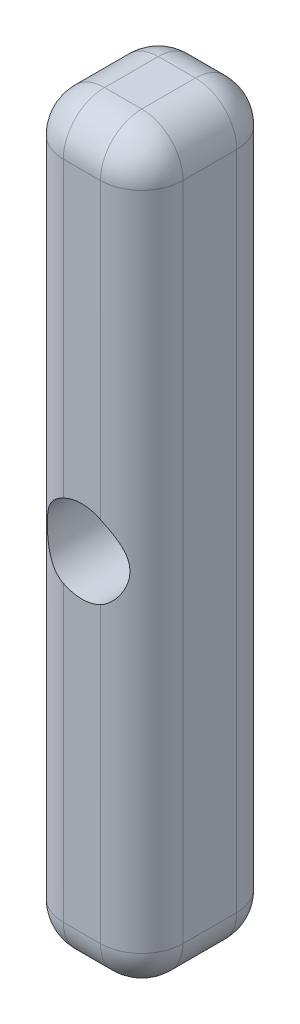
from build123d import *

# Parameters (mm, degrees)
SKETCH7_W           = 90
SKETCH7_H           = 14.5
BOSS_EXTRUDE1_DEPTH = 16.5
SKETCH8_R           = 5
CUT_EXTRUDE2_DEPTH  = 13
FILLET1_R           = 5


with BuildPart() as part:
    # Sketch7 → Boss-Extrude1 (new body)
    with BuildSketch(Plane(origin=(0, 0, 0), x_dir=(0, 1, 0), z_dir=(0, 0, 1))):
        Rectangle(SKETCH7_W, SKETCH7_H)
    extrude(amount=BOSS_EXTRUDE1_DEPTH)

    # Sketch8 → Cut-Extrude2 (cut)
    with BuildSketch(Plane(origin=(0, 0, 16.5), x_dir=(0, -1, 0), z_dir=(0, 0, 1))):
        with Locations(Location((0, 0, 0), (0, 0, 90))):
            Circle(SKETCH8_R)
    extrude(amount=-CUT_EXTRUDE2_DEPTH, mode=Mode.SUBTRACT)

    # Fillet1
    # the kernel refuses this fillet: 5 mm, written as the material it takes off along each edge
    with BuildSketch(Plane(origin=(-2.25, -40, 11.5), x_dir=(0, 0, 1), z_dir=(0, -1, 0))) as fillet1_piece_1_section:
        Polygon((0, 0), (FILLET1_R, 0), (FILLET1_R, FILLET1_R), (0, FILLET1_R), align=None)
    fillet1_piece_1 = extrude(amount=FILLET1_R, mode=Mode.PRIVATE)
    fillet1_piece_1 = fillet1_piece_1 - Plane(origin=(-2.25, -40, 11.5), x_dir=(0.7071067811865475, 0, -0.7071067811865475), z_dir=(0, -1, 0)) * Sphere(FILLET1_R, mode=Mode.PRIVATE)
    add(fillet1_piece_1, mode=Mode.SUBTRACT)
    with BuildSketch(Plane(origin=(2.25, -40, 11.5), x_dir=(0, -1, 0), z_dir=(1, 0, 0))) as fillet1_piece_2_section:
        Polygon((0, 0), (FILLET1_R, 0), (FILLET1_R, -FILLET1_R), (0, -FILLET1_R), align=None)
    fillet1_piece_2 = extrude(amount=FILLET1_R, mode=Mode.PRIVATE)
    fillet1_piece_2 = fillet1_piece_2 - Plane(origin=(2.25, -40, 11.5), x_dir=(0, 0.7071067811865475, -0.7071067811865475), z_dir=(1, 0, 0)) * Sphere(FILLET1_R, mode=Mode.PRIVATE)
    add(fillet1_piece_2, mode=Mode.SUBTRACT)
    with BuildSketch(Plane(origin=(2.25, 40, 11.5), x_dir=(0, 1, 0), z_dir=(1, 0, 0))) as fillet1_piece_3_section:
        Polygon((0, 0), (FILLET1_R, 0), (FILLET1_R, FILLET1_R), (0, FILLET1_R), align=None)
    fillet1_piece_3 = extrude(amount=FILLET1_R, mode=Mode.PRIVATE)
    fillet1_piece_3 = fillet1_piece_3 - Plane(origin=(2.25, 40, 11.5), x_dir=(0, -0.7071067811865475, -0.7071067811865475), z_dir=(1, 0, 0)) * Sphere(FILLET1_R, mode=Mode.PRIVATE)
    add(fillet1_piece_3, mode=Mode.SUBTRACT)
    with BuildSketch(Plane(origin=(-2.25, 40, 11.5), x_dir=(0, 0, 1), z_dir=(0, 1, 0))) as fillet1_piece_4_section:
        Polygon((0, 0), (FILLET1_R, 0), (FILLET1_R, -FILLET1_R), (0, -FILLET1_R), align=None)
    fillet1_piece_4 = extrude(amount=FILLET1_R, mode=Mode.PRIVATE)
    fillet1_piece_4 = fillet1_piece_4 - Plane(origin=(-2.25, 40, 11.5), x_dir=(0.7071067811865475, 0, -0.7071067811865475), z_dir=(0, 1, 0)) * Sphere(FILLET1_R, mode=Mode.PRIVATE)
    add(fillet1_piece_4, mode=Mode.SUBTRACT)
    with BuildSketch(Plane(origin=(2.25, -40, 5), x_dir=(0, -1, 0), z_dir=(1, 0, 0))) as fillet1_piece_5_section:
        Polygon((0, 0), (FILLET1_R, 0), (FILLET1_R, FILLET1_R), (0, FILLET1_R), align=None)
    fillet1_piece_5 = extrude(amount=FILLET1_R, mode=Mode.PRIVATE)
    fillet1_piece_5 = fillet1_piece_5 - Plane(origin=(2.25, -40, 5), x_dir=(0, 0.7071067811865475, 0.7071067811865475), z_dir=(1, 0, 0)) * Sphere(FILLET1_R, mode=Mode.PRIVATE)
    add(fillet1_piece_5, mode=Mode.SUBTRACT)
    with BuildSketch(Plane(origin=(2.25, 40, 5), x_dir=(0, 1, 0), z_dir=(1, 0, 0))) as fillet1_piece_6_section:
        Polygon((0, 0), (FILLET1_R, 0), (FILLET1_R, -FILLET1_R), (0, -FILLET1_R), align=None)
    fillet1_piece_6 = extrude(amount=FILLET1_R, mode=Mode.PRIVATE)
    fillet1_piece_6 = fillet1_piece_6 - Plane(origin=(2.25, 40, 5), x_dir=(0, -0.7071067811865475, 0.7071067811865475), z_dir=(1, 0, 0)) * Sphere(FILLET1_R, mode=Mode.PRIVATE)
    add(fillet1_piece_6, mode=Mode.SUBTRACT)
    with BuildSketch(Plane(origin=(-2.25, -40, 5), x_dir=(0, 0, -1), z_dir=(0, -1, 0))) as fillet1_piece_7_section:
        Polygon((0, 0), (FILLET1_R, 0), (FILLET1_R, -FILLET1_R), (0, -FILLET1_R), align=None)
    fillet1_piece_7 = extrude(amount=FILLET1_R, mode=Mode.PRIVATE)
    fillet1_piece_7 = fillet1_piece_7 - Plane(origin=(-2.25, -40, 5), x_dir=(0.7071067811865475, 0, 0.7071067811865475), z_dir=(0, -1, 0)) * Sphere(FILLET1_R, mode=Mode.PRIVATE)
    add(fillet1_piece_7, mode=Mode.SUBTRACT)
    with BuildSketch(Plane(origin=(-2.25, 40, 5), x_dir=(0, 0, -1), z_dir=(0, 1, 0))) as fillet1_piece_8_section:
        Polygon((0, 0), (FILLET1_R, 0), (FILLET1_R, FILLET1_R), (0, FILLET1_R), align=None)
    fillet1_piece_8 = extrude(amount=FILLET1_R, mode=Mode.PRIVATE)
    fillet1_piece_8 = fillet1_piece_8 - Plane(origin=(-2.25, 40, 5), x_dir=(0.7071067811865475, 0, 0.7071067811865475), z_dir=(0, 1, 0)) * Sphere(FILLET1_R, mode=Mode.PRIVATE)
    add(fillet1_piece_8, mode=Mode.SUBTRACT)
    with BuildSketch(Plane(origin=(-2.25, -45, 16.5), x_dir=(0, 0, -1), z_dir=(1, 0, 0)), Plane(origin=(2.25, 45, 16.5), x_dir=(0, 0, -1), z_dir=(-1, 0, 0))) as fillet1_piece_9:
        with BuildLine():
            CenterArc((FILLET1_R, FILLET1_R), FILLET1_R, 180, 90)
            Line((0, FILLET1_R), (0, 0))
            Line((0, 0), (FILLET1_R, 0))
        make_face()
    extrude(amount=4.5, mode=Mode.SUBTRACT)
    with BuildSketch(Plane(origin=(7.25, -40, 16.5), x_dir=(0, 0, -1), z_dir=(0, 1, 0)), Plane(origin=(-7.25, 40, 0), x_dir=(1, 0, 0), z_dir=(0, -1, 0))) as fillet1_piece_10:
        with BuildLine():
            CenterArc((FILLET1_R, FILLET1_R), FILLET1_R, 180, 90)
            Line((0, FILLET1_R), (0, 0))
            Line((0, 0), (FILLET1_R, 0))
        make_face()
    extrude(amount=80, mode=Mode.SUBTRACT)
    with BuildSketch(Plane(origin=(7.25, -40, 0), x_dir=(0, 0, 1), z_dir=(0, 1, 0)), Plane(origin=(-7.25, 40, 16.5), x_dir=(1, 0, 0), z_dir=(0, -1, 0))) as fillet1_piece_11:
        with BuildLine():
            CenterArc((FILLET1_R, -FILLET1_R), FILLET1_R, 90, 90)
            Line((0, -FILLET1_R), (0, 0))
            Line((0, 0), (FILLET1_R, 0))
        make_face()
    extrude(amount=80, mode=Mode.SUBTRACT)
    with BuildSketch(Plane(origin=(-2.25, -45, 0), x_dir=(0, 0, 1), z_dir=(1, 0, 0)), Plane(origin=(2.25, 45, 0), x_dir=(0, 0, 1), z_dir=(-1, 0, 0))) as fillet1_piece_12:
        with BuildLine():
            CenterArc((FILLET1_R, -FILLET1_R), FILLET1_R, 90, 90)
            Line((0, -FILLET1_R), (0, 0))
            Line((0, 0), (FILLET1_R, 0))
        make_face()
    extrude(amount=4.5, mode=Mode.SUBTRACT)
    with BuildSketch(Plane(origin=(7.25, 45, 5), x_dir=(0, -1, 0), z_dir=(0, 0, 1)), Plane(origin=(-7.25, 45, 5), x_dir=(1, 0, 0), z_dir=(0, 0, 1))) as fillet1_piece_13:
        with BuildLine():
            CenterArc((FILLET1_R, -FILLET1_R), FILLET1_R, 90, 90)
            Line((0, -FILLET1_R), (0, 0))
            Line((0, 0), (FILLET1_R, 0))
        make_face()
    extrude(amount=6.5, mode=Mode.SUBTRACT)
    with BuildSketch(Plane(origin=(7.25, -45, 5), x_dir=(0, 1, 0), z_dir=(0, 0, 1)), Plane(origin=(-7.25, -45, 5), x_dir=(1, 0, 0), z_dir=(0, 0, 1))) as fillet1_piece_14:
        with BuildLine():
            CenterArc((FILLET1_R, FILLET1_R), FILLET1_R, 180, 90)
            Line((0, FILLET1_R), (0, 0))
            Line((0, 0), (FILLET1_R, 0))
        make_face()
    extrude(amount=6.5, mode=Mode.SUBTRACT)


solid = part.part
